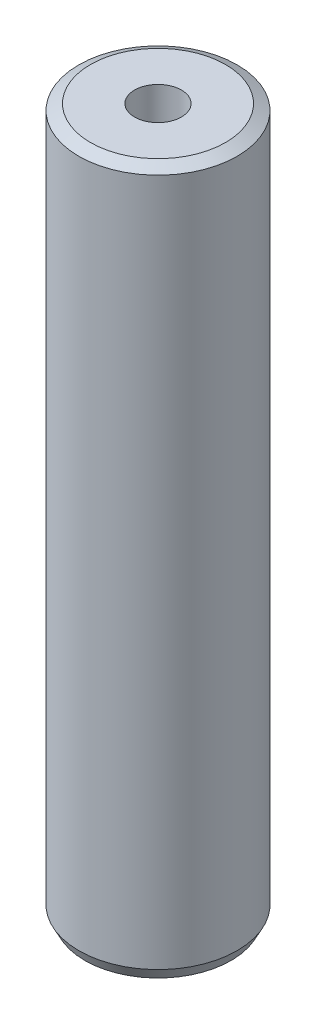
from build123d import *
from OCP.BRepFilletAPI import BRepFilletAPI_MakeChamfer

# Parameters (mm, degrees)
SKETCH1_R           = 52.5
BOSS_EXTRUDE1_DEPTH = 467.791931014
SKETCH2_R           = 15.523875217
CUT_EXTRUDE1_DEPTH  = 474.647327367
CHAMFER1_SIZE       = 4.032503561
CHAMFER1_SIZE2      = 7.706794316


with BuildPart() as part:
    # Sketch1 → Boss-Extrude1 (new body)
    with BuildSketch(Plane(origin=(0, 0, 0), x_dir=(1, 0, 0), z_dir=(0, 1, 0))):
        Circle(SKETCH1_R)
    extrude(amount=BOSS_EXTRUDE1_DEPTH)

    # Sketch2 → Cut-Extrude1 (cut, through all)
    with BuildSketch(Plane(origin=(0, 0, 0), x_dir=(1, 0, 0), z_dir=(0, 1, 0))):
        Circle(SKETCH2_R)
    extrude(amount=CUT_EXTRUDE1_DEPTH, mode=Mode.SUBTRACT)

    # Chamfer1: one chamfer whose edges measure the first distance from different faces: ONE call of the kernel's chamfer builder (chamfer() names one face for all edges)
    chamfer1_edges_1 = [part.edges().sort_by_distance(p)[0] for p in [
        (-52.5, 467.791931014, 0),
    ]]
    chamfer1_side_1 = [part.faces().sort_by_distance(p)[0] for p in [
        (-52.5, 233.895965507, 0),
    ]]
    chamfer1_edges_2 = [part.edges().sort_by_distance(p)[0] for p in [
        (-52.5, 0, 0),
    ]]
    chamfer1_side_2 = [part.faces().sort_by_distance(p)[0] for p in [
        (-51.01507576, 0, 0),
    ]]
    chamfer1 = BRepFilletAPI_MakeChamfer(part.part.solid().wrapped)
    for e in chamfer1_edges_1:
        chamfer1.Add(CHAMFER1_SIZE, CHAMFER1_SIZE2, e.wrapped, chamfer1_side_1[0].wrapped)  # the first distance lies on this face
    for e in chamfer1_edges_2:
        chamfer1.Add(CHAMFER1_SIZE, CHAMFER1_SIZE2, e.wrapped, chamfer1_side_2[0].wrapped)  # the first distance lies on this face
    add(Compound.cast(chamfer1.Shape()), mode=Mode.REPLACE)


solid = part.part
